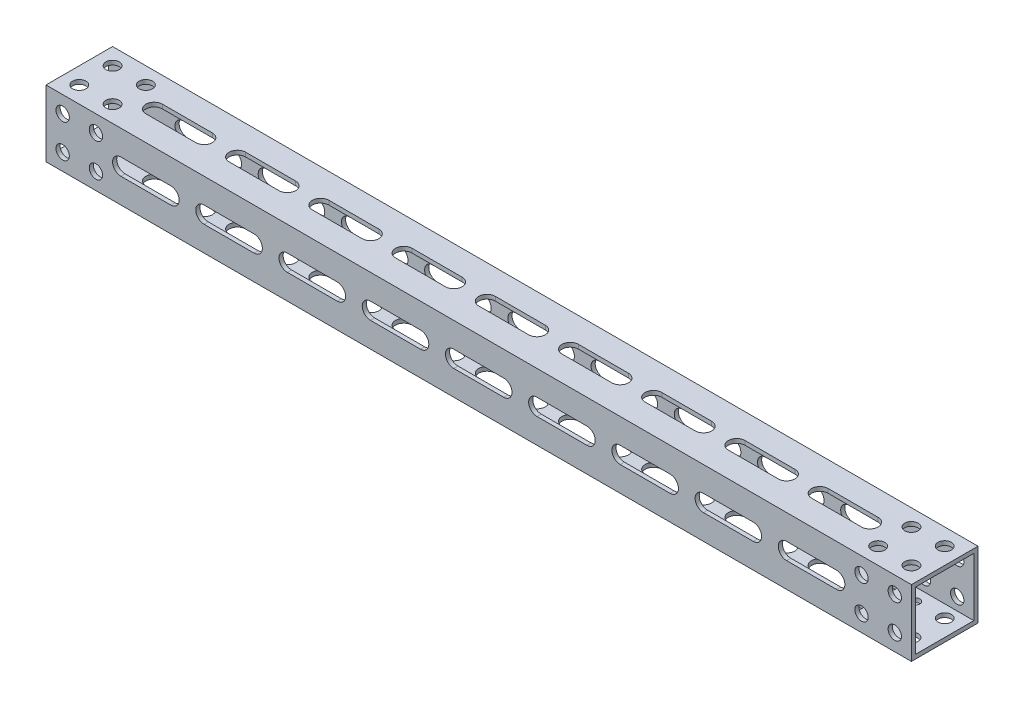
from build123d import *

# Parameters (mm, degrees)
SKETCH1_W                      = 25.4
SKETCH1_H                      = 25.4
SKETCH1_W_2                    = 22.225
SKETCH1_H_2                    = 22.225
EXTRUDE_THIN1_DEPTH            = 330.2
F_30_0_13_DIAMETER_HOLE1_D     = 3.302
F_30_0_13_DIAMETER_HOLE1_DEPTH = 1.5875
CUT_EXTRUDE1_DEPTH             = 332.418904108
CUT_EXTRUDE2_DEPTH             = 332.418904108
F_10_CLEARANCE_HOLE1_D         = 5.1054
F_10_CLEARANCE_HOLE2_D         = 5.1054
DELETEFACE1_START              = -12.7
DELETEFACE1_DEPTH              = 1.5875


# Read off the part's stored shape, not the designer's step: DeleteFace1
with BuildPart() as part:
    # Sketch1 → Extrude-Thin1 (new body)
    with BuildSketch(Plane(origin=(0, 0, 0), x_dir=(0, 0, -1), z_dir=(1, 0, 0))):
        Rectangle(SKETCH1_W, SKETCH1_H)
        Rectangle(SKETCH1_W_2, SKETCH1_H_2, mode=Mode.SUBTRACT)
    extrude(amount=EXTRUDE_THIN1_DEPTH)

    # #30 (0.13) Diameter Hole1
    with Locations(Plane.XZ.offset(12.7)):
        with Locations((17.4625, -6.35), (26.9875, 6.35), (26.9875, -6.35), (17.4625, 6.35), (71.4375, -6.35), (61.9125, -6.35), (61.9125, 6.35), (71.4375, 6.35), (258.7625, 6.35), (268.2875, 6.35), (268.2875, -6.35), (258.7625, -6.35), (312.7375, 6.35), (303.2125, -6.35), (303.2125, 6.35), (312.7375, -6.35)):
            Hole(F_30_0_13_DIAMETER_HOLE1_D / 2, depth=F_30_0_13_DIAMETER_HOLE1_DEPTH)

    # Sketch5 → Cut-Extrude1 (cut, through all)
    with BuildSketch(Plane(origin=(0, 12.7, 0), x_dir=(1, 0, 0), z_dir=(0, 1, 0))):
        with BuildLine():
            Line((28.575, 3.175), (47.625, 3.175))
            ThreePointArc((47.625, 3.175), (50.8, 0), (47.625, -3.175))
            Line((47.625, -3.175), (28.575, -3.175))
            ThreePointArc((28.575, -3.175), (25.4, 0), (28.575, 3.175))
        make_face()
        with BuildLine():
            Line((60.325, 3.175), (79.375, 3.175))
            ThreePointArc((79.375, 3.175), (82.55, 0), (79.375, -3.175))
            Line((79.375, -3.175), (60.325, -3.175))
            ThreePointArc((60.325, -3.175), (57.15, 0), (60.325, 3.175))
        make_face()
        with BuildLine():
            Line((92.075, 3.175), (111.125, 3.175))
            ThreePointArc((111.125, 3.175), (114.3, 0), (111.125, -3.175))
            Line((111.125, -3.175), (92.075, -3.175))
            ThreePointArc((92.075, -3.175), (88.9, 0), (92.075, 3.175))
        make_face()
        with BuildLine():
            Line((123.825, 3.175), (142.875, 3.175))
            ThreePointArc((142.875, 3.175), (146.05, 0), (142.875, -3.175))
            Line((142.875, -3.175), (123.825, -3.175))
            ThreePointArc((123.825, -3.175), (120.65, 0), (123.825, 3.175))
        make_face()
        with BuildLine():
            Line((155.575, 3.175), (174.625, 3.175))
            ThreePointArc((174.625, 3.175), (177.8, 0), (174.625, -3.175))
            Line((174.625, -3.175), (155.575, -3.175))
            ThreePointArc((155.575, -3.175), (152.4, 0), (155.575, 3.175))
        make_face()
        with BuildLine():
            Line((187.325, 3.175), (206.375, 3.175))
            ThreePointArc((206.375, 3.175), (209.55, 0), (206.375, -3.175))
            Line((206.375, -3.175), (187.325, -3.175))
            ThreePointArc((187.325, -3.175), (184.15, 0), (187.325, 3.175))
        make_face()
        with BuildLine():
            Line((219.075, 3.175), (238.125, 3.175))
            ThreePointArc((238.125, 3.175), (241.3, 0), (238.125, -3.175))
            Line((238.125, -3.175), (219.075, -3.175))
            ThreePointArc((219.075, -3.175), (215.9, 0), (219.075, 3.175))
        make_face()
        with BuildLine():
            Line((250.825, 3.175), (269.875, 3.175))
            ThreePointArc((269.875, 3.175), (273.05, 0), (269.875, -3.175))
            Line((269.875, -3.175), (250.825, -3.175))
            ThreePointArc((250.825, -3.175), (247.65, 0), (250.825, 3.175))
        make_face()
        with BuildLine():
            Line((282.575, 3.175), (301.625, 3.175))
            ThreePointArc((301.625, 3.175), (304.8, 0), (301.625, -3.175))
            Line((301.625, -3.175), (282.575, -3.175))
            ThreePointArc((282.575, -3.175), (279.4, 0), (282.575, 3.175))
        make_face()
    extrude(amount=-CUT_EXTRUDE1_DEPTH, mode=Mode.SUBTRACT)

    # Sketch6 → Cut-Extrude2 (cut, through all)
    with BuildSketch(Plane.XY.offset(12.7)):
        with BuildLine():
            Line((28.575, 3.175), (47.625, 3.175))
            ThreePointArc((47.625, 3.175), (50.8, 0), (47.625, -3.175))
            Line((47.625, -3.175), (28.575, -3.175))
            ThreePointArc((28.575, -3.175), (25.4, 0), (28.575, 3.175))
        make_face()
        with BuildLine():
            Line((60.325, 3.175), (79.375, 3.175))
            ThreePointArc((79.375, 3.175), (82.55, 0), (79.375, -3.175))
            Line((79.375, -3.175), (60.325, -3.175))
            ThreePointArc((60.325, -3.175), (57.15, 0), (60.325, 3.175))
        make_face()
        with BuildLine():
            Line((92.075, 3.175), (111.125, 3.175))
            ThreePointArc((111.125, 3.175), (114.3, 0), (111.125, -3.175))
            Line((111.125, -3.175), (92.075, -3.175))
            ThreePointArc((92.075, -3.175), (88.9, 0), (92.075, 3.175))
        make_face()
        with BuildLine():
            Line((123.825, 3.175), (142.875, 3.175))
            ThreePointArc((142.875, 3.175), (146.05, 0), (142.875, -3.175))
            Line((142.875, -3.175), (123.825, -3.175))
            ThreePointArc((123.825, -3.175), (120.65, 0), (123.825, 3.175))
        make_face()
        with BuildLine():
            Line((155.575, 3.175), (174.625, 3.175))
            ThreePointArc((174.625, 3.175), (177.8, 0), (174.625, -3.175))
            Line((174.625, -3.175), (155.575, -3.175))
            ThreePointArc((155.575, -3.175), (152.4, 0), (155.575, 3.175))
        make_face()
        with BuildLine():
            Line((187.325, 3.175), (206.375, 3.175))
            ThreePointArc((206.375, 3.175), (209.55, 0), (206.375, -3.175))
            Line((206.375, -3.175), (187.325, -3.175))
            ThreePointArc((187.325, -3.175), (184.15, 0), (187.325, 3.175))
        make_face()
        with BuildLine():
            Line((219.075, 3.175), (238.125, 3.175))
            ThreePointArc((238.125, 3.175), (241.3, 0), (238.125, -3.175))
            Line((238.125, -3.175), (219.075, -3.175))
            ThreePointArc((219.075, -3.175), (215.9, 0), (219.075, 3.175))
        make_face()
        with BuildLine():
            Line((250.825, 3.175), (269.875, 3.175))
            ThreePointArc((269.875, 3.175), (273.05, 0), (269.875, -3.175))
            Line((269.875, -3.175), (250.825, -3.175))
            ThreePointArc((250.825, -3.175), (247.65, 0), (250.825, 3.175))
        make_face()
        with BuildLine():
            Line((282.575, 3.175), (301.625, 3.175))
            ThreePointArc((301.625, 3.175), (304.8, 0), (301.625, -3.175))
            Line((301.625, -3.175), (282.575, -3.175))
            ThreePointArc((282.575, -3.175), (279.4, 0), (282.575, 3.175))
        make_face()
    extrude(amount=-CUT_EXTRUDE2_DEPTH, mode=Mode.SUBTRACT)

    # #10 Clearance Hole1 (through all)
    with Locations(Plane.XY.offset(12.7)):
        with Locations((6.35, -6.35), (19.05, -6.35), (19.05, 6.35), (6.35, 6.35), (323.85, 6.35), (311.15, 6.35), (311.15, -6.35), (323.85, -6.35)):
            Hole(F_10_CLEARANCE_HOLE1_D / 2)

    # #10 Clearance Hole2 (through all)
    with Locations(Plane(origin=(0, 12.7, 0), x_dir=(1, 0, 0), z_dir=(0, 1, 0))):
        with Locations((6.35, 6.35), (19.05, 6.35), (19.05, -6.35), (6.35, -6.35), (323.85, -6.35), (311.15, -6.35), (311.15, 6.35), (323.85, 6.35)):
            Hole(F_10_CLEARANCE_HOLE2_D / 2)

    # DeleteFace1 outline → DeleteFace1 (add)
    with BuildSketch(Plane(origin=(0, 0, 0), x_dir=(1, 0, 0), z_dir=(0, 1, 0)).offset(DELETEFACE1_START)):
        with BuildLine():
            ThreePointArc((313.1376008, 4.748213388), (311.0865, 6.35), (313.1376008, 7.951786612))
            ThreePointArc((313.1376008, 7.951786612), (308.5973, 6.35), (313.1376008, 4.748213388))
        make_face()
        with BuildLine():
            ThreePointArc((313.1376008, -7.951786612), (311.0865, -6.35), (313.1376008, -4.748213388))
            ThreePointArc((313.1376008, -4.748213388), (308.5973, -6.35), (313.1376008, -7.951786612))
        make_face()
        with BuildLine():
            ThreePointArc((17.0623992, -4.748213388), (19.1135, -6.35), (17.0623992, -7.951786612))
            ThreePointArc((17.0623992, -7.951786612), (21.6027, -6.35), (17.0623992, -4.748213388))
        make_face()
        with BuildLine():
            ThreePointArc((17.0623992, 7.951786612), (19.1135, 6.35), (17.0623992, 4.748213388))
            ThreePointArc((17.0623992, 4.748213388), (21.6027, 6.35), (17.0623992, 7.951786612))
        make_face()
    extrude(amount=DELETEFACE1_DEPTH)


solid = part.part
